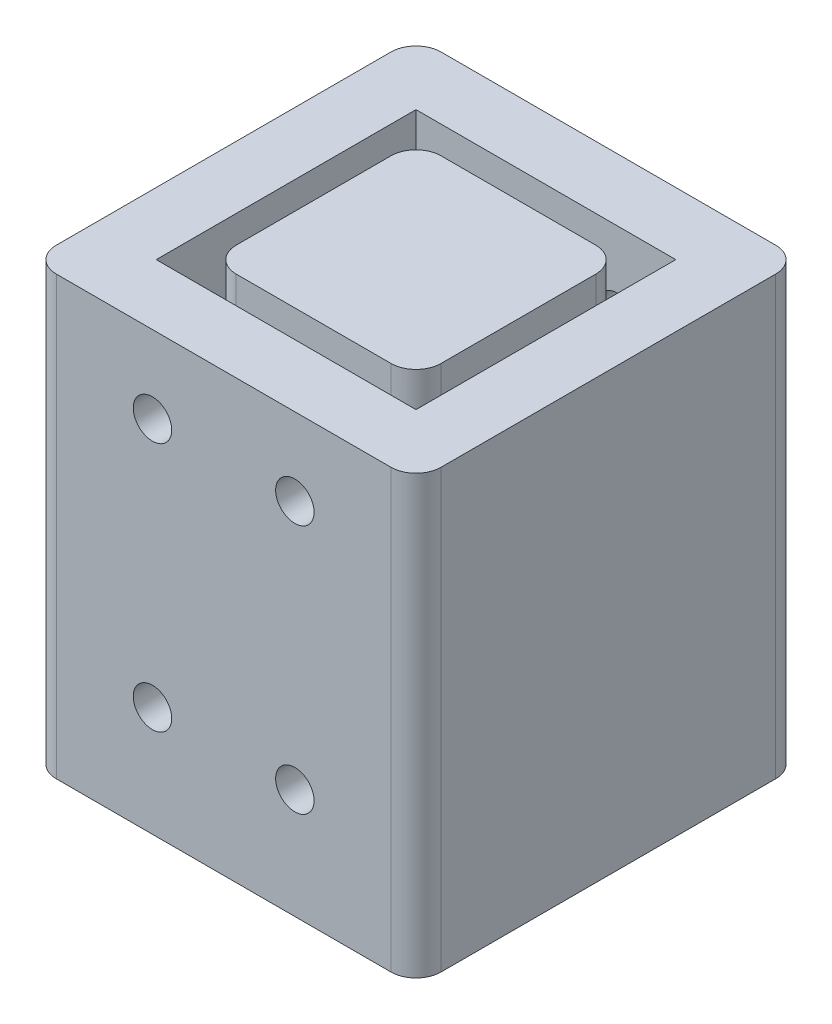
from build123d import *

# Parameters (mm, degrees)
SKETCH1_W             = 20.828
SKETCH1_H             = 20.828
BOSS_EXTRUDE1_DEPTH   = 38.1
SKETCH1_W_2           = 39.116
SKETCH1_H_2           = 39.116
SKETCH1_W_3           = 26.416
SKETCH1_H_3           = 26.416
BOSS_EXTRUDE1_2_DEPTH = 38.1
SKETCH2_R             = 1.9558
CUT_EXTRUDE1_DEPTH    = 59.001610495
SKETCH1_2_W           = 39.116
SKETCH1_2_H           = 39.116
SKETCH1_2_W_2         = 26.416
SKETCH1_2_H_2         = 26.416
SKETCH1_2_W_3         = 20.828
SKETCH1_2_H_3         = 20.828
BOSS_EXTRUDE2_DEPTH   = 6.35
FILLET1_R             = 2.54


with BuildPart() as part:
    # Sketch1 → Boss-Extrude1 (new body)
    with BuildSketch(Plane(origin=(0, 0, 0), x_dir=(1, 0, 0), z_dir=(0, 1, 0))):
        Rectangle(SKETCH1_W, SKETCH1_H)
    extrude(amount=BOSS_EXTRUDE1_DEPTH)


with BuildPart() as body_2:
    # Sketch1 → Boss-Extrude1 2 (new body)
    with BuildSketch(Plane(origin=(0, 0, 0), x_dir=(1, 0, 0), z_dir=(0, 1, 0))):
        Rectangle(SKETCH1_W_2, SKETCH1_H_2)
        Rectangle(SKETCH1_W_3, SKETCH1_H_3, mode=Mode.SUBTRACT)
    extrude(amount=BOSS_EXTRUDE1_2_DEPTH)


with BuildPart() as cut_extrude1_tool:
    # Sketch2 → Cut-Extrude1 (new, through all)
    with BuildSketch(Plane.XY.offset(19.558)):
        with Locations((-7.239, 30.226)):
            Circle(SKETCH2_R)
        with Locations((7.239, 30.226)):
            Circle(SKETCH2_R)
        with Locations((7.239, 4.826)):
            Circle(SKETCH2_R)
        with Locations((-7.239, 4.826)):
            Circle(SKETCH2_R)
    extrude(amount=-CUT_EXTRUDE1_DEPTH)


with BuildPart() as part_1:
    add(part.part)

    # Cut-Extrude1: cut by cut_extrude1_tool
    add(cut_extrude1_tool.part, mode=Mode.SUBTRACT)



with BuildPart() as body_2_1:
    add(body_2.part)

    # Cut-Extrude1: cut by cut_extrude1_tool
    add(cut_extrude1_tool.part, mode=Mode.SUBTRACT)


with BuildPart() as part_2:
    add(part_1.part)

    add(body_2_1.part)  # Boss-Extrude2 merges body 2
    # Sketch1<2> → Boss-Extrude2 (add)
    # profile 1 of 3: a face of its own
    with BuildSketch(Plane(origin=(0, 0, 0), x_dir=(1, 0, 0), z_dir=(0, 1, 0))):
        Rectangle(SKETCH1_2_W, SKETCH1_2_H)
        Rectangle(SKETCH1_2_W_2, SKETCH1_2_H_2, mode=Mode.SUBTRACT)
    # profile 2 of 3: a face of its own
    with BuildSketch(Plane(origin=(0, 0, 0), x_dir=(1, 0, 0), z_dir=(0, 1, 0))):
        Rectangle(SKETCH1_2_W_2, SKETCH1_2_H_2)
        Rectangle(SKETCH1_2_W_3, SKETCH1_2_H_3, mode=Mode.SUBTRACT)
    # profile 3 of 3: a face of its own
    with BuildSketch(Plane(origin=(0, 0, 0), x_dir=(1, 0, 0), z_dir=(0, 1, 0))):
        Rectangle(SKETCH1_2_W_3, SKETCH1_2_H_3)
    extrude(amount=-BOSS_EXTRUDE2_DEPTH)

    # Fillet1
    # the kernel refuses this fillet: 2.54 mm, written as the material it takes off along each edge
    with BuildSketch(Plane(origin=(-19.558, 44.45, -19.558), x_dir=(0, 0, 1), z_dir=(0, -1, 0)), Plane(origin=(-19.558, -12.7, 19.558), x_dir=(0, 0, -1), z_dir=(0, 1, 0))) as fillet1_piece_1:
        with BuildLine():
            CenterArc((FILLET1_R, -FILLET1_R), FILLET1_R, 90, 90)
            Line((0, -FILLET1_R), (0, 0))
            Line((0, 0), (FILLET1_R, 0))
        make_face()
    extrude(amount=57.15, mode=Mode.SUBTRACT)
    with BuildSketch(Plane(origin=(19.558, 44.45, -19.558), x_dir=(0, 0, 1), z_dir=(0, -1, 0)), Plane(origin=(19.558, -12.7, 19.558), x_dir=(0, 0, -1), z_dir=(0, 1, 0))) as fillet1_piece_2:
        with BuildLine():
            CenterArc((FILLET1_R, FILLET1_R), FILLET1_R, 180, 90)
            Line((0, FILLET1_R), (0, 0))
            Line((0, 0), (FILLET1_R, 0))
        make_face()
    extrude(amount=57.15, mode=Mode.SUBTRACT)
    with BuildSketch(Plane(origin=(10.414, 0, -10.414), x_dir=(-1, 0, 0), z_dir=(0, 1, 0)), Plane(origin=(-10.414, 0, -10.414), x_dir=(0, 0, 1), z_dir=(0, 1, 0))) as fillet1_piece_3:
        with BuildLine():
            CenterArc((FILLET1_R, FILLET1_R), FILLET1_R, 180, 90)
            Line((0, FILLET1_R), (0, 0))
            Line((0, 0), (FILLET1_R, 0))
        make_face()
    extrude(amount=44.45, mode=Mode.SUBTRACT)
    with BuildSketch(Plane(origin=(-10.414, 0, 10.414), x_dir=(0, 0, -1), z_dir=(0, 1, 0)), Plane(origin=(10.414, 0, 10.414), x_dir=(-1, 0, 0), z_dir=(0, 1, 0))) as fillet1_piece_4:
        with BuildLine():
            CenterArc((FILLET1_R, -FILLET1_R), FILLET1_R, 90, 90)
            Line((0, -FILLET1_R), (0, 0))
            Line((0, 0), (FILLET1_R, 0))
        make_face()
    extrude(amount=44.45, mode=Mode.SUBTRACT)


solid = part_2.part
